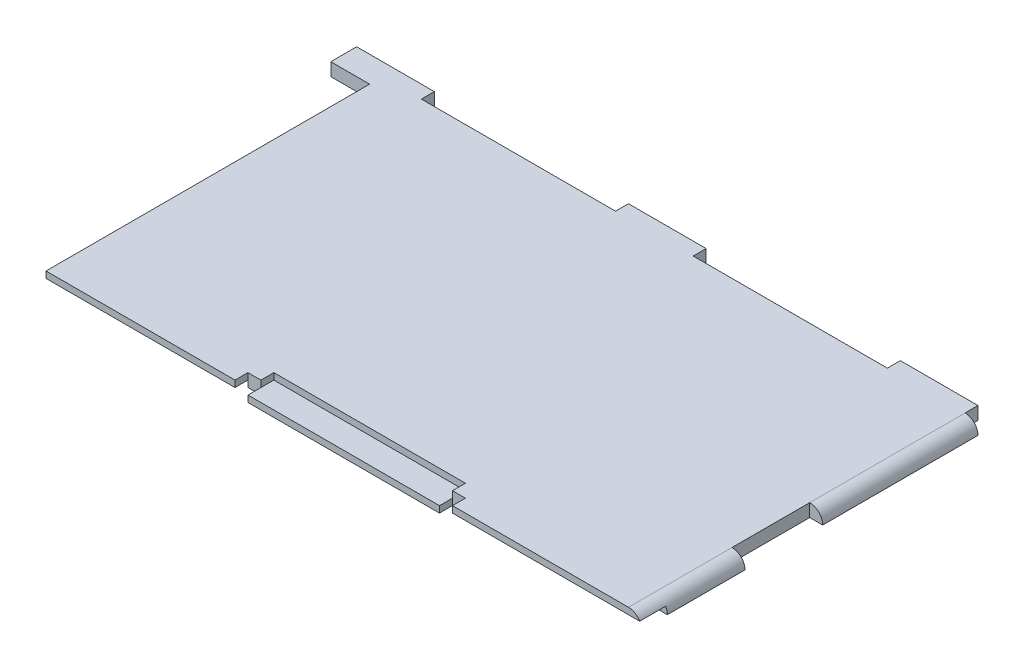
from build123d import *

# Parameters (mm, degrees)
SKETCH_1_W          = 5
SKETCH_1_H          = 60
SKETCH_1_W_2        = 30
SKETCH_1_H_2        = 5
SKETCH_1_W_3        = 15
EXTRUDE_1_DEPTH     = 5
FILLET_1_R          = 5
SKETCH_2_W          = 239.490005879
SKETCH_2_H          = 213.108485662
CUT_EXTRUDE_2_DEPTH = 10
SKETCH_3_W          = 73
SKETCH_3_H          = 2.5
SKETCH_3_W_2        = 74
CUT_EXTRUDE_3_DEPTH = 10
SKETCH_4_W          = 5
SKETCH_4_H          = 5
CUT_EXTRUDE_4_DEPTH = 5


with BuildPart() as part:
    # 草圖1 → 填料-伸長1 (new body)
    with BuildSketch(Plane(origin=(0, 0, 0), x_dir=(1, 0, 0), z_dir=(0, 1, 0))):
        Polygon((198.746286718, -286.464902661), (198.746286718, -256.464902661), (183.246286718, -256.464902661), (183.246286718, -266.464902661), (124.746286718, -266.464902661), (124.746286718, -262.464902661), (109.246286718, -262.464902661), (109.246286718, -266.464902661), (-21.253713282, -266.464902661), (-21.253713282, 38.535097339), (-36.253713282, 38.535097339), (-36.253713282, 43.535097339), (203.746286718, 43.535097339), (203.746286718, -286.464902661), align=None)
        with Locations((206.246286718, -256.464902661)):
            Rectangle(SKETCH_1_W, SKETCH_1_H)
        with Locations((206.246286718, 13.535097339)):
            Rectangle(SKETCH_1_W, SKETCH_1_H)
        with Locations((188.746286718, 46.035097339)):
            Rectangle(SKETCH_1_W_2, SKETCH_1_H_2)
        with Locations((-21.253713282, 46.035097339)):
            Rectangle(SKETCH_1_W_2, SKETCH_1_H_2)
        with Locations((91.246286718, 46.035097339)):
            Rectangle(SKETCH_1_W_3, SKETCH_1_H_2)
        with Locations((76.246286718, 46.035097339)):
            Rectangle(SKETCH_1_W_3, SKETCH_1_H_2)
        with Locations((206.246286718, -166.464902661)):
            Rectangle(SKETCH_1_W, SKETCH_1_H)
        with Locations((206.246286718, -76.464902661)):
            Rectangle(SKETCH_1_W, SKETCH_1_H)
    extrude(amount=EXTRUDE_1_DEPTH)

    # 圓角1
    fillet_1_edges = [part.edges().sort_by_distance(p)[0] for p in [
        (208.746286718, 5, -13.535097339),
        (208.746286718, 5, 76.464902661),
        (208.746286718, 5, 166.464902661),
        (208.746286718, 5, 256.464902661),
    ]]
    fillet(fillet_1_edges, radius=FILLET_1_R - 0.0001)  # a hair under: the kernel refuses the full size

    # 草圖2 → 除料-伸長2 (cut)
    with BuildSketch(Plane(origin=(0, 5, 0), x_dir=(1, 0, 0), z_dir=(0, 1, 0))):
        with Locations((89.001283779, -193.019145492)):
            Rectangle(SKETCH_2_W, SKETCH_2_H)
    extrude(amount=-CUT_EXTRUDE_2_DEPTH, mode=Mode.SUBTRACT)

    # 草圖3 → 除料-伸長3 (cut)
    with BuildSketch(Plane.XY.offset(86.464902661)):
        with Locations((15.246286718, 1.25)):
            Rectangle(SKETCH_3_W, SKETCH_3_H)
        with Locations((172.246286718, 1.25)):
            Rectangle(SKETCH_3_W, SKETCH_3_H)
        with Locations((93.746286718, 3.75)):
            Rectangle(SKETCH_3_W_2, SKETCH_3_H)
    extrude(amount=-CUT_EXTRUDE_3_DEPTH, mode=Mode.SUBTRACT)

    # 草圖4 → 除料-伸長4 (cut)
    with BuildSketch(Plane.XY.offset(86.464902661)):
        with Locations((54.246286718, 2.5)):
            Rectangle(SKETCH_4_W, SKETCH_4_H)
        with Locations((133.246286718, 2.5)):
            Rectangle(SKETCH_4_W, SKETCH_4_H)
    extrude(amount=-CUT_EXTRUDE_4_DEPTH, mode=Mode.SUBTRACT)


solid = part.part
